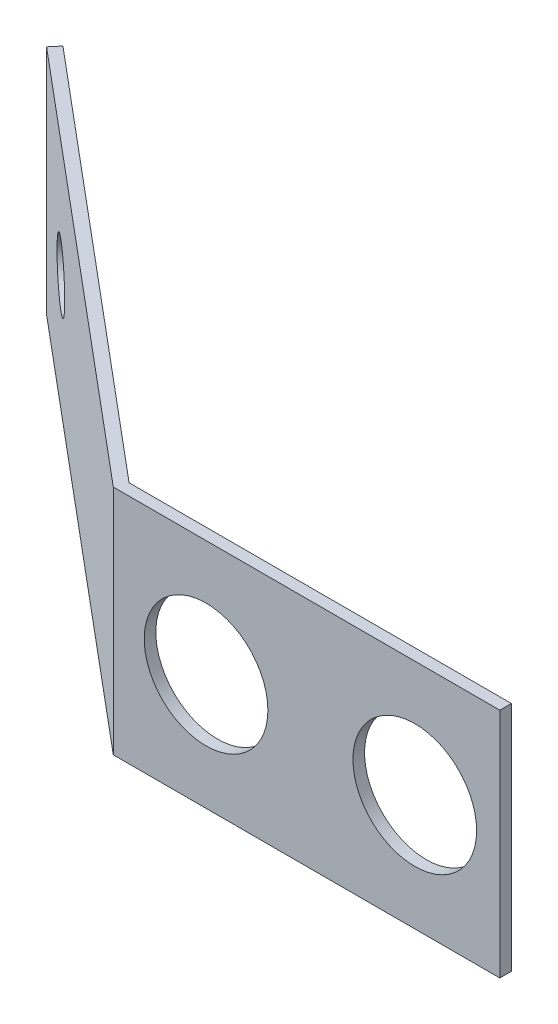
from build123d import *

# Parameters (mm, degrees)
EXTRUDE_THIN1_DEPTH = 30
SKETCH2_R           = 4
CUT_EXTRUDE1_DEPTH  = 10
SKETCH3_R           = 8
CUT_EXTRUDE2_DEPTH  = 10


with BuildPart() as part:
    # Sketch1 → Extrude-Thin1 (new body)
    with BuildSketch(Plane(origin=(0, 0, 0), x_dir=(1, 0, 0), z_dir=(0, 1, 0))):
        Polygon((-53.623111018, 44.995132678), (0, 0), (50, 0), (50, 1.5), (0.545955351, 1.5), (-52.658929604, 46.144199343), align=None)
    extrude(amount=EXTRUDE_THIN1_DEPTH)

    # Sketch2 → Cut-Extrude1 (cut)
    with BuildSketch(Plane(origin=(0, 0, 0), x_dir=(0.766044443118982, 0, 0.6427876096865347), z_dir=(-0.6427876096865348, 0, 0.766044443118982))):
        with Locations((-55, 15)):
            Circle(SKETCH2_R)
    extrude(amount=-CUT_EXTRUDE1_DEPTH, mode=Mode.SUBTRACT)

    # Sketch3 → Cut-Extrude2 (cut)
    with BuildSketch(Plane.XY):
        with Locations((12, 15)):
            Circle(SKETCH3_R)
        with Locations((39, 15)):
            Circle(SKETCH3_R)
    extrude(amount=-CUT_EXTRUDE2_DEPTH, mode=Mode.SUBTRACT)


solid = part.part
